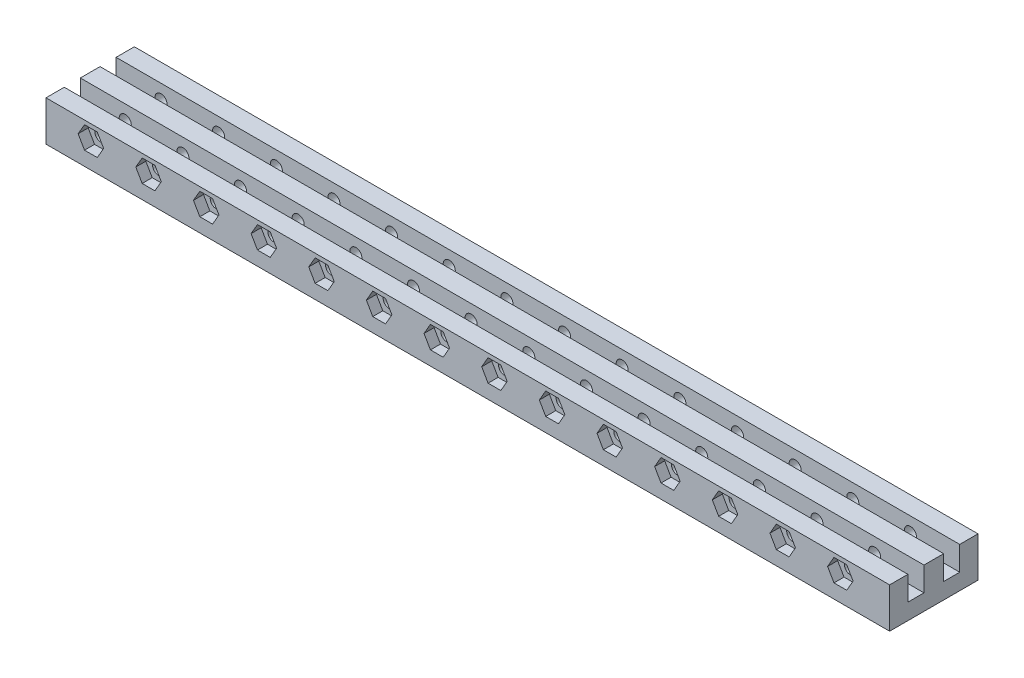
from build123d import *

# Parameters (mm, degrees)
SKETCH1_W           = 210
SKETCH1_H           = 22
BOSS_EXTRUDE1_DEPTH = 10
SKETCH2_W           = 210
SKETCH2_H           = 4
CUT_EXTRUDE1_DEPTH  = 6
CUT_EXTRUDE3_DEPTH  = 2.5
SKETCH9_R           = 1.5
CUT_EXTRUDE4_DEPTH  = 108.745069493


with BuildPart() as part:
    # Sketch1 → Boss-Extrude1 (new body)
    with BuildSketch(Plane(origin=(0, 0, 0), x_dir=(1, 0, 0), z_dir=(0, 1, 0))):
        Rectangle(SKETCH1_W, SKETCH1_H)
    extrude(amount=BOSS_EXTRUDE1_DEPTH)

    # Sketch2 → Cut-Extrude1 (cut)
    with BuildSketch(Plane(origin=(0, 10, 0), x_dir=(1, 0, 0), z_dir=(0, 1, 0))):
        with Locations((0, -4.450418011)):
            Rectangle(SKETCH2_W, SKETCH2_H)
        with Locations((0, 4.450418011)):
            Rectangle(SKETCH2_W, SKETCH2_H)
    extrude(amount=-CUT_EXTRUDE1_DEPTH, mode=Mode.SUBTRACT)

    # Sketch3 → Cut-Extrude3 (cut)
    with BuildSketch(Plane.XY.offset(11)):
        Polygon((-90.649147039, 6.25), (-92.236860279, 9), (-95.41228676, 9), (-97, 6.25), (-95.41228676, 3.5), (-92.236860279, 3.5), align=None)
        Polygon((-82.649147039, 6.25), (-81.061433799, 9), (-77.886007318, 9), (-76.298294078, 6.25), (-77.886007318, 3.5), (-81.061433799, 3.5), align=None)
        Polygon((-63.535154357, 9), (-66.710580838, 9), (-68.298294078, 6.25), (-66.710580838, 3.5), (-63.535154357, 3.5), (-61.947441117, 6.25), align=None)
        Polygon((-52.359727876, 3.5), (-53.947441117, 6.25), (-52.359727876, 9), (-49.184301396, 9), (-47.596588156, 6.25), (-49.184301396, 3.5), align=None)
        Polygon((-34.833448435, 9), (-38.008874915, 9), (-39.596588156, 6.25), (-38.008874915, 3.5), (-34.833448435, 3.5), (-33.245735195, 6.25), align=None)
        Polygon((-23.658021954, 3.5), (-25.245735195, 6.25), (-23.658021954, 9), (-20.482595474, 9), (-18.894882233, 6.25), (-20.482595474, 3.5), align=None)
        Polygon((-4.544029272, 6.25), (-6.131742513, 9), (-9.307168993, 9), (-10.894882233, 6.25), (-9.307168993, 3.5), (-6.131742513, 3.5), align=None)
        Polygon((3.455970728, 6.25), (5.043683968, 9), (8.219110448, 9), (9.806823689, 6.25), (8.219110448, 3.5), (5.043683968, 3.5), align=None)
        Polygon((22.56996341, 9), (19.394536929, 9), (17.806823689, 6.25), (19.394536929, 3.5), (22.56996341, 3.5), (24.15767665, 6.25), align=None)
        Polygon((33.74538989, 3.5), (32.15767665, 6.25), (33.74538989, 9), (36.920816371, 9), (38.508529611, 6.25), (36.920816371, 3.5), align=None)
        Polygon((51.271669332, 9), (48.096242851, 9), (46.508529611, 6.25), (48.096242851, 3.5), (51.271669332, 3.5), (52.859382572, 6.25), align=None)
        Polygon((62.447095812, 3.5), (60.859382572, 6.25), (62.447095812, 9), (65.622522293, 9), (67.210235533, 6.25), (65.622522293, 3.5), align=None)
        Polygon((81.561088494, 6.25), (79.973375254, 9), (76.797948773, 9), (75.210235533, 6.25), (76.797948773, 3.5), (79.973375254, 3.5), align=None)
        Polygon((89.561088494, 6.25), (91.148801734, 9), (94.324228215, 9), (95.911941455, 6.25), (94.324228215, 3.5), (91.148801734, 3.5), align=None)
    extrude(amount=-CUT_EXTRUDE3_DEPTH, mode=Mode.SUBTRACT)

    # Sketch9 → Cut-Extrude4 (cut, through all)
    with BuildSketch(Plane.XY.offset(11)):
        with Locations((-93.824573519, 6.25)):
            Circle(SKETCH9_R)
        with Locations((-79.473720558, 6.25)):
            Circle(SKETCH9_R)
        with Locations((-65.122867597, 6.25)):
            Circle(SKETCH9_R)
        with Locations((-50.772014636, 6.25)):
            Circle(SKETCH9_R)
        with Locations((-36.421161675, 6.25)):
            Circle(SKETCH9_R)
        with Locations((-22.070308714, 6.25)):
            Circle(SKETCH9_R)
        with Locations((-7.719455753, 6.25)):
            Circle(SKETCH9_R)
        with Locations((6.631397208, 6.25)):
            Circle(SKETCH9_R)
        with Locations((20.982250169, 6.25)):
            Circle(SKETCH9_R)
        with Locations((35.33310313, 6.25)):
            Circle(SKETCH9_R)
        with Locations((49.683956091, 6.25)):
            Circle(SKETCH9_R)
        with Locations((64.034809052, 6.25)):
            Circle(SKETCH9_R)
        with Locations((78.385662014, 6.25)):
            Circle(SKETCH9_R)
        with Locations((92.736514975, 6.25)):
            Circle(SKETCH9_R)
    extrude(amount=-CUT_EXTRUDE4_DEPTH, mode=Mode.SUBTRACT)


solid = part.part
